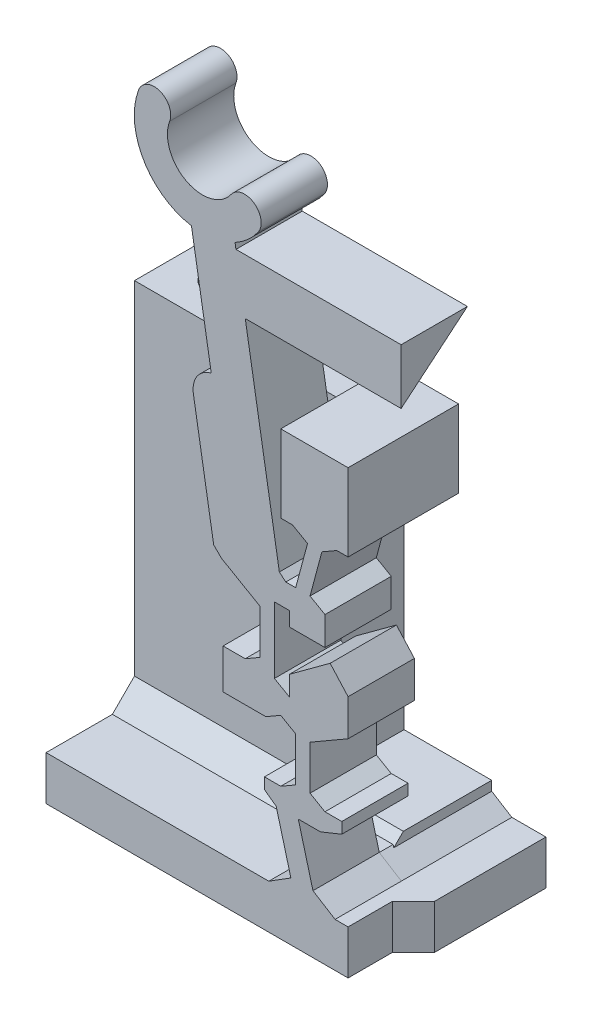
from build123d import *

# Parameters (mm, degrees)
BOSS_SWITCH_BODY_DEPTH                    = 3
SKETCH1_W                                 = 4
SKETCH1_H                                 = 3.5
BOSS_FLANGE_WIDTH_DEPTH                   = 5
BOSS_FLANGE_HEIGHT_REACH                  = 35.863
SKETCH2_W                                 = 4
SKETCH2_H                                 = 2
SKETCH2_W_2                               = 8
CUT_UP_TO_DOWN_DERAILLEUR_CLEARANCE_REACH = 21.462
SKETCH10_W                                = 2.453096586
SKETCH10_H                                = 3
SKETCH17_W                                = 12.1675
SKETCH17_H                                = 4
BOSS_FLANGE_SUPPORT_DEPTH                 = 14.5
TAP_DRILL_FOR_M2X0_4_TAP1_D               = 1.6
M2_CLEARANCE_HOLE2_D                      = 2.4
M2_CLEARANCE_HOLE2_DEPTH                  = 15
M2_CLEARANCE_HOLE2_TIP                    = 0.721032743
CHAMFER_FLANGE_SUPPORT_SIZE               = 1.5
CHAMFER_FLANGE_SUPPORT_2_SIZE             = 1.5
CHAMFER_FLANGE_SUPPORT_3_SIZE             = 1
SKETCH23_W                                = 3.9675
SKETCH23_H                                = 12
CUT_GAP_FOR_PRINTING_DEPTH                = 32.000499688
SKETCH25_W                                = 0.953096586
SKETCH25_H                                = 3.5
CUT_DERAILLEUR_CLEARANCE_DEPTH            = 32.145320369
CHAMFER8_SIZE                             = 1
CUT_EXTRUDE1_REACH                        = 30.441
SKETCH26_W                                = 7.075346244
SKETCH26_H                                = 3.905124838
CUT_WIDE_DERAILLEUR_CLEARANCE_DEPTH       = 33.195879702
CUT_WIDE_DERAILLEUR_CLEARANCE_DEPTH_BACK  = 4
SKETCH27_W                                = 2
SKETCH27_H                                = 5
CHAMFER9_SIZE                             = 1


# Some blends are built 0.0001 mm under size
with BuildPart() as part:
    # Sketch-SwitchBossUp → Boss-Switch Body (new body)
    with BuildSketch(Plane.XY):
        with BuildLine():
            Line((5.581091201, 12.555245643), (5.581100766, 11.263016279))
            Line((5.581100766, 11.263016279), (3.971265023, 11.263016279))
            Line((3.971265023, 11.263016279), (3.971265023, 11.909403061))
            Line((3.971265023, 11.909403061), (3.296271341, 11.909403061))
            Line((3.296271341, 11.909403061), (3.296271341, 11.409403061))
            Line((3.296271341, 11.409403061), (3.296271341, 9.409403061))
            Line((3.296271341, 9.409403061), (3.296271341, 8.909403061))
            Line((3.296271341, 8.909403061), (3.971278743, 8.519687356))
            Line((3.971278743, 8.519687356), (3.971278743, 9.409408058))
            Line((3.971278743, 9.409408058), (5.815189336, 10.763016279))
            Line((5.815189336, 10.763016279), (6.627976927, 9.860324207))
            Line((6.627976927, 9.860324207), (6.627976927, 8.210536506))
            Line((6.627976927, 8.210536506), (5.581127833, 7.606137899))
            Line((5.581127833, 7.606137899), (4.906138119, 7.216432406))
            Line((4.906138119, 7.216432406), (4.906138119, 5.216432406))
            Line((4.906138119, 5.216432406), (5.58114552, 4.826716701))
            Line((5.58114552, 4.826716701), (6.342350466, 4.826716701))
            Line((6.342350466, 4.826716701), (6.342350466, 4.326716701))
            Line((6.342350466, 4.326716701), (5.374946804, 3.937018274))
            Line((5.374946804, 3.937018274), (4.374946804, 3.937018274))
            Line((4.374946804, 3.937018274), (5.038286759, 1.461399857))
            Line((5.038286759, 1.461399857), (6.03883266, 0.837018274))
            Line((6.03883266, 0.837018274), (6.627976927, 0.837018274))
            Line((6.627976927, 0.837018274), (6.627976927, -1.165310653))
            Line((6.627976927, -1.165310653), (5.038286759, -1.165310653))
            Line((5.038286759, -1.165310653), (3.03883266, -1.165310653))
            Line((3.03883266, -1.165310653), (3.03883266, 0.834689347))
            Line((3.03883266, 0.834689347), (4.03855971, 1.460381193))
            Line((4.03855971, 1.460381193), (3.374946804, 3.937018274))
            Line((3.374946804, 3.937018274), (2.842350466, 4.326720436))
            Line((2.842350466, 4.326720436), (2.842350466, 4.826720436))
            Line((2.842350466, 4.826720436), (3.58114552, 4.826720436))
            Line((3.58114552, 4.826720436), (4.256138119, 5.216427595))
            Line((4.256138119, 5.216427595), (4.256138119, 7.216427595))
            Line((4.256138119, 7.216427595), (3.581130717, 7.6061433))
            Line((3.581130717, 7.6061433), (2.9061262, 7.216422599))
            Line((2.9061262, 7.216422599), (0.971281627, 7.216422599))
            Line((0.971281627, 7.216422599), (0.971281627, 9.019692757))
            Line((0.971281627, 9.019692757), (1.971281627, 9.019692757))
            Line((1.971281627, 9.019692757), (2.646271341, 9.40939825))
            Line((2.646271341, 9.40939825), (2.646271341, 11.40939825))
            Line((2.646271341, 11.40939825), (0.897326855, 12.41915182))
            Line((0.897326855, 12.41915182), (0.545466745, 12.771663724))
            Line((0.545466745, 12.771663724), (-0.372784255, 18.226393961))
            ThreePointArc((-0.372784255, 18.226393961), (-0.209313172, 18.996084896), (0.435897335, 19.446473985))
            Line((0.435897335, 19.446473985), (-0.46073685, 24.772792819))
            ThreePointArc((-0.46073685, 24.772792819), (-2.630501593, 26.270619745), (-2.852546321, 28.897797067))
            ThreePointArc((-2.852546321, 28.897797067), (-1.887813913, 29.338582026), (-1.447028953, 28.373849618))
            ThreePointArc((-1.447028953, 28.373849618), (-0.703448682, 26.416936722), (1.333779254, 26.898727173))
            ThreePointArc((1.333779254, 26.898727173), (2.379722745, 27.074801628), (2.555797201, 26.028858137))
            ThreePointArc((2.555797201, 26.028858137), (2.086504637, 25.507104397), (1.511513111, 25.104801997))
            Line((1.511513111, 25.104801997), (1.553598189, 24.854801997))
            Line((1.553598189, 24.854801997), (9.027976927, 24.854801997))
            Line((9.027976927, 24.854801997), (9.027976927, 22.354801997))
            Line((9.027976927, 22.354801997), (1.974448974, 22.354801997))
            Line((1.974448974, 22.354801997), (3.516958068, 13.191761617))
            Line((3.516958068, 13.191761617), (3.808459197, 12.945132837))
            Line((3.808459197, 12.945132837), (4.256080915, 12.944958203))
            Line((4.256080915, 12.944958203), (4.791964496, 14.944962169))
            Line((4.791964496, 14.944962169), (4.116925685, 15.334689347))
            Line((4.116925685, 15.334689347), (3.581073513, 15.334689347))
            Line((3.581073513, 15.334689347), (3.581073513, 18.834689347))
            Line((3.581073513, 18.834689347), (5.725580434, 18.834689347))
            Line((5.725580434, 18.834689347), (6.627976927, 18.834689347))
            Line((6.627976927, 18.834689347), (6.627976927, 15.334689347))
            Line((6.627976927, 15.334689347), (6.116971898, 15.334689347))
            Line((6.116971898, 15.334689347), (5.441964496, 14.94496698))
            Line((5.441964496, 14.94496698), (4.906080915, 12.944963014))
            Line((4.906080915, 12.944963014), (5.581091201, 12.555245643))
        make_face()
    extrude(amount=BOSS_SWITCH_BODY_DEPTH)

    # Sketch1 → Boss-Flange Width (add)
    with BuildSketch(Plane(origin=(0, 0, 0), x_dir=(-1, 0, 0), z_dir=(0, 0, -1))):
        Polygon((-7.581073513, -1.165310653), (0.412170615, -1.165310653), (0.412170615, 0.834689347), (-3.03883266, 0.834689347), (-4.03855971, 1.460381193), (-5.03855971, 1.460381193), (-6.03883266, 0.837018274), (-7.581073513, 0.837018274), align=None)
        with Locations((-5.581073513, 17.084689347)):
            Rectangle(SKETCH1_W, SKETCH1_H)
    extrude(amount=BOSS_FLANGE_WIDTH_DEPTH)

    # Sketch2 → Boss-Flange Height (add, up to next)
    with BuildSketch(Plane(origin=(-7.039523073, 0, 0), x_dir=(0, 0, -1), z_dir=(1, 0, 0)), mode=Mode.PRIVATE) as boss_flange_height_sk1:
        with Locations((3, 16.334689347)):
            Rectangle(SKETCH2_W, SKETCH2_H)
    boss_flange_height_tool1 = extrude(boss_flange_height_sk1.sketch, amount=BOSS_FLANGE_HEIGHT_REACH, mode=Mode.PRIVATE) - part.part
    # Sketch2 → Boss-Flange Height (add, up to next)
    with BuildSketch(Plane(origin=(-7.039523073, 0, 0), x_dir=(0, 0, -1), z_dir=(1, 0, 0)), mode=Mode.PRIVATE) as boss_flange_height_sk2:
        with Locations((1, -0.165310653)):
            Rectangle(SKETCH2_W_2, SKETCH2_H)
    boss_flange_height_tool2 = extrude(boss_flange_height_sk2.sketch, amount=BOSS_FLANGE_HEIGHT_REACH, mode=Mode.PRIVATE) - part.part
    add(boss_flange_height_tool1.solids().sort_by_distance((-7.039523, 16.334689, -3))[0])
    add(boss_flange_height_tool2.solids().sort_by_distance((-7.039523, -0.165311, -1))[0])

    # Sketch10 → Cut-Up-To-Down Derailleur Clearance (cut, up to next)
    with BuildSketch(Plane(origin=(0, 15.334689347, 0), x_dir=(1, 0, 0), z_dir=(0, 1, 0)), mode=Mode.PRIVATE) as cut_up_to_down_derailleur_clearance_sk1:
        with Locations((6.35452522, 3.5)):
            Rectangle(SKETCH10_W, SKETCH10_H)
    cut_up_to_down_derailleur_clearance_tool1 = extrude(cut_up_to_down_derailleur_clearance_sk1.sketch, amount=CUT_UP_TO_DOWN_DERAILLEUR_CLEARANCE_REACH, mode=Mode.PRIVATE) & part.part
    add(cut_up_to_down_derailleur_clearance_tool1.solids().sort_by_distance((6.354525, 15.334689, -3.5))[0], mode=Mode.SUBTRACT)

    # Sketch17 → Boss-Flange Support (add)
    with BuildSketch(Plane.XZ.offset(-15.334689347)):
        with Locations((-0.955773073, -3)):
            Rectangle(SKETCH17_W, SKETCH17_H)
    extrude(amount=BOSS_FLANGE_SUPPORT_DEPTH)

    # Tap Drill for M2x0.4 Tap1 (through all)
    with Locations(Plane(origin=(0, -1.165310653, 0), x_dir=(-1, 0, 0), z_dir=(0, -1, 0))):
        with Locations((5.039523073, 3), (0.539523073, 3)):
            Hole(TAP_DRILL_FOR_M2X0_4_TAP1_D / 2)

    # M2 Clearance Hole2
    with Locations(Plane.XZ.offset(1.165310653)):
        with Locations((-5.039523073, -3), (-0.539523073, -3)):
            Hole(M2_CLEARANCE_HOLE2_D / 2, depth=M2_CLEARANCE_HOLE2_DEPTH)
            with Locations((0, 0, -(M2_CLEARANCE_HOLE2_DEPTH + M2_CLEARANCE_HOLE2_TIP / 2))):  # 118° drill point
                Cone(0, M2_CLEARANCE_HOLE2_D / 2, M2_CLEARANCE_HOLE2_TIP, mode=Mode.SUBTRACT)

    # Chamfer-Flange Support
    chamfer_flange_support_edges = [part.edges().sort_by_distance(p)[0] for p in [
        (3.581073513, 17.334689347, -3),
    ]]
    chamfer(chamfer_flange_support_edges, length=CHAMFER_FLANGE_SUPPORT_SIZE - 0.0001)  # a hair under: the kernel refuses the full size

    # Chamfer-Flange Support 2
    chamfer_flange_support_2_edges = [part.edges().sort_by_distance(p)[0] for p in [
        (5.127976927, 17.084689347, -2),
        (5.127976927, 15.334689347, -1.5),
    ]]
    chamfer(chamfer_flange_support_2_edges, length=CHAMFER_FLANGE_SUPPORT_2_SIZE)

    # Chamfer-Flange Support 3
    chamfer_flange_support_3_edges = [part.edges().sort_by_distance(p)[0] for p in [
        (-2.000345206, 0.834689347, -1),
    ]]
    chamfer(chamfer_flange_support_3_edges, length=CHAMFER_FLANGE_SUPPORT_3_SIZE)

    # Sketch23 → Cut-Gap for Printing (cut, through all)
    with BuildSketch(Plane.XY.offset(-1)):
        with Locations((3.144226927, 7.834689347)):
            Rectangle(SKETCH23_W, SKETCH23_H)
    extrude(amount=-CUT_GAP_FOR_PRINTING_DEPTH, mode=Mode.SUBTRACT)

    # Sketch25 → Cut-Derailleur Clearance (cut, through all)
    with BuildSketch(Plane.XY):
        with Locations((7.10452522, 17.084689347)):
            Rectangle(SKETCH25_W, SKETCH25_H)
    extrude(amount=-CUT_DERAILLEUR_CLEARANCE_DEPTH, mode=Mode.SUBTRACT)

    # Chamfer8
    # the kernel refuses this chamfer: 1 mm, written as the material it adds along each edge
    with BuildSketch(Plane(origin=(6.627976927, 0.837018274, 0), x_dir=(-0.027495876610586494, 0, 0.9996219169112968), z_dir=(0, -1, 0))) as chamfer8_piece_1_section:
        Polygon((CHAMFER8_SIZE * 0.999621916911, -CHAMFER8_SIZE * 0.0274958766106), (-CHAMFER8_SIZE * 0.0274958766106, -CHAMFER8_SIZE * 0.999621916911), (0, 0), align=None)
    chamfer8_piece_1 = extrude(amount=2.002328927, mode=Mode.PRIVATE)
    chamfer8_piece_1 = split(chamfer8_piece_1, bisect_by=Plane(origin=(7.581073513, -0.16414619, 0.332375145), z_dir=(-1, 0, 0)), keep=Keep.TOP, mode=Mode.PRIVATE)
    add(chamfer8_piece_1)

    # Sketch26 → Cut-Extrude1 (cut, up to next)
    with BuildSketch(Plane(origin=(-5.954769273, 8.400426305, 7.000355254), x_dir=(-0.8782236755158304, -0.3674019179359696, -0.30616826494664123), z_dir=(0.47825011841448156, -0.6746701157774819, -0.5622250964812346)), mode=Mode.PRIVATE) as cut_extrude1_sk1:
        with Locations((-16.492565132, 13.959094076)):
            Rectangle(SKETCH26_W, SKETCH26_H)
    cut_extrude1_tool1 = extrude(cut_extrude1_sk1.sketch, amount=CUT_EXTRUDE1_REACH, mode=Mode.PRIVATE) & part.part
    add(cut_extrude1_tool1.solids().sort_by_distance((8.529392, 23.396221, 1.326182))[0], mode=Mode.SUBTRACT)

    # Sketch27 → Cut-Wide Derailleur Clearance (cut, two sides: drawn at the far end of the back side and taken through both)
    with BuildSketch(Plane(origin=(5.127976927, 0, 0), x_dir=(0, 0, -1), z_dir=(1, 0, 0)).offset(-CUT_WIDE_DERAILLEUR_CLEARANCE_DEPTH_BACK)):
        with Locations((4, 16.334689347)):
            Rectangle(SKETCH27_W, SKETCH27_H)
    extrude(amount=CUT_WIDE_DERAILLEUR_CLEARANCE_DEPTH + CUT_WIDE_DERAILLEUR_CLEARANCE_DEPTH_BACK, mode=Mode.SUBTRACT)

    # Chamfer9
    chamfer9_edges = [part.edges().sort_by_distance(p)[0] for p in [
        (4.60452522, 18.834689347, -3),
    ]]
    chamfer(chamfer9_edges, length=CHAMFER9_SIZE)


solid = part.part
